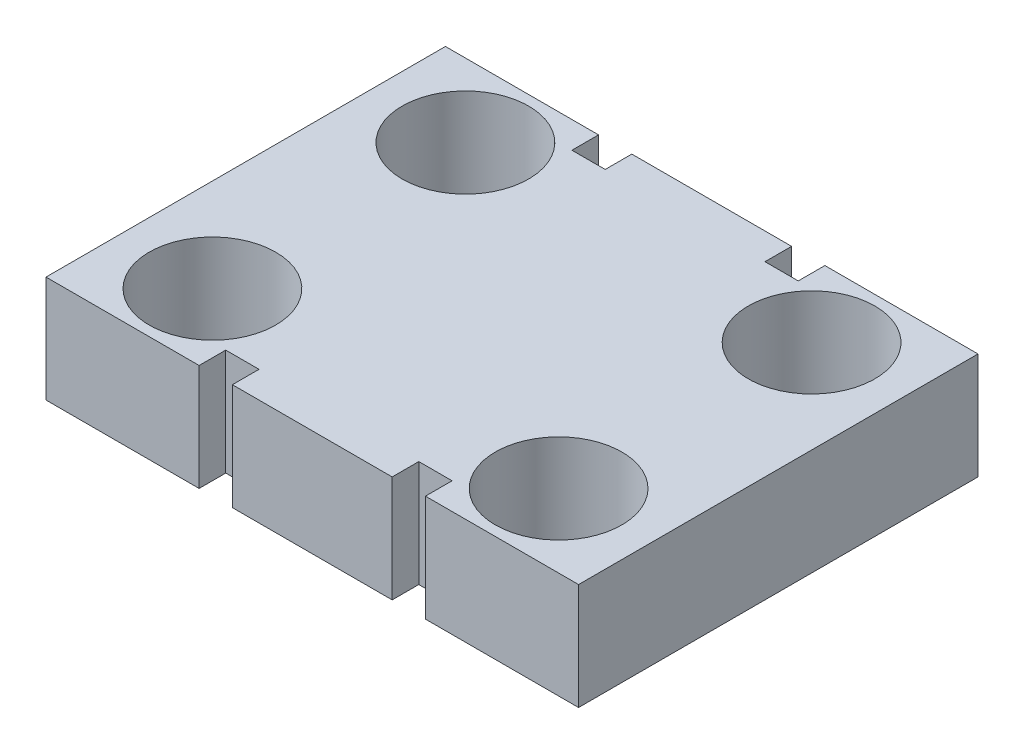
from build123d import *

# Parameters (mm, degrees)
SKETCH1_W           = 40
SKETCH1_H           = 30
BOSS_EXTRUDE1_DEPTH = 8
SKETCH2_R           = 4.75
CUT_EXTRUDE1_DEPTH  = 7
SKETCH3_R           = 5.5
CUT_EXTRUDE2_DEPTH  = 6
SKETCH4_W           = 2.5
SKETCH4_H           = 2
CUT_EXTRUDE3_DEPTH  = 15


with BuildPart() as part:
    # Sketch1 → Boss-Extrude1 (new body)
    with BuildSketch(Plane(origin=(0, 0, 0), x_dir=(1, 0, 0), z_dir=(0, 1, 0))):
        with Locations((-20, 15)):
            Rectangle(SKETCH1_W, SKETCH1_H)
    extrude(amount=BOSS_EXTRUDE1_DEPTH)

    # Sketch2 → Cut-Extrude1 (cut)
    with BuildSketch(Plane(origin=(0, 8, 0), x_dir=(1, 0, 0), z_dir=(0, 1, 0))):
        with Locations((-33, 24.5)):
            Circle(SKETCH2_R)
        with Locations((-33, 5.5)):
            Circle(SKETCH2_R)
        with Locations((-7, 5.5)):
            Circle(SKETCH2_R)
        with Locations((-7, 24.5)):
            Circle(SKETCH2_R)
    extrude(amount=-CUT_EXTRUDE1_DEPTH, mode=Mode.SUBTRACT)

    # Sketch3 → Cut-Extrude2 (cut)
    with BuildSketch(Plane.XZ):
        with Locations((-20, -15)):
            Circle(SKETCH3_R)
    extrude(amount=-CUT_EXTRUDE2_DEPTH, mode=Mode.SUBTRACT)

    # Sketch4 → Cut-Extrude3 (cut)
    with BuildSketch(Plane.XZ):
        with Locations((-12.75, -1)):
            Rectangle(SKETCH4_W, SKETCH4_H)
        with Locations((-27.25, -1)):
            Rectangle(SKETCH4_W, SKETCH4_H)
        with Locations((-12.75, -29)):
            Rectangle(SKETCH4_W, SKETCH4_H)
        with Locations((-27.25, -29)):
            Rectangle(SKETCH4_W, SKETCH4_H)
    extrude(amount=-CUT_EXTRUDE3_DEPTH, mode=Mode.SUBTRACT)


solid = part.part
